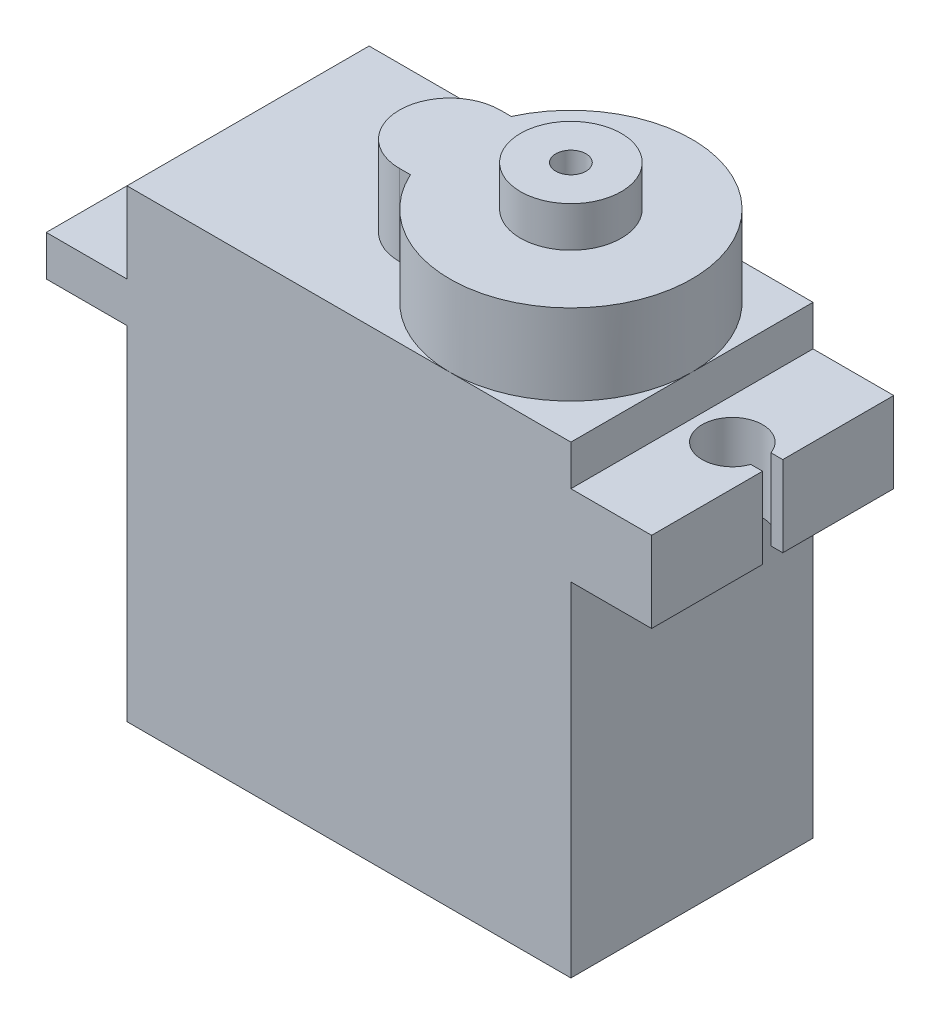
from build123d import *

# Parameters (mm, degrees)
CROQUIS1_W              = 22
CROQUIS1_H              = 23
SALIENTE_EXTRUIR1_DEPTH = 12
CROQUIS2_W              = 12
CROQUIS2_H              = 2
SALIENTE_EXTRUIR2_DEPTH = 5
CORTAR_EXTRUIR2_DEPTH   = 2
CROQUIS13_W             = 12
CROQUIS13_H             = 2
SALIENTE_EXTRUIR3_DEPTH = 4
CORTAR_EXTRUIR3_DEPTH   = 2
SALIENTE_EXTRUIR4_DEPTH = 4
CROQUIS16_R             = 2.5
SALIENTE_EXTRUIR5_DEPTH = 6
CROQUIS21_R             = 0.75
CORTAR_EXTRUIR6_DEPTH   = 2


with BuildPart() as part:
    # Croquis1 → Saliente-Extruir1 (new body)
    with BuildSketch(Plane.XY):
        with Locations((-25.140327955, -0.424857882)):
            Rectangle(CROQUIS1_W, CROQUIS1_H)
    extrude(amount=SALIENTE_EXTRUIR1_DEPTH)

    # Croquis2 → Saliente-Extruir2 (add)
    with BuildSketch(Plane(origin=(-14.140327955, 0, 0), x_dir=(0, 0, -1), z_dir=(1, 0, 0))):
        with Locations((-6, 6.075142118)):
            Rectangle(CROQUIS2_W, CROQUIS2_H)
    saliente_extruir2 = extrude(amount=SALIENTE_EXTRUIR2_DEPTH)

    # Croquis3 → Cortar-Extruir2 (cut)
    with BuildSketch(Plane(origin=(0, 7.075142118, 0), x_dir=(1, 0, 0), z_dir=(0, 1, 0))):
        with BuildLine():
            Line((-10.140327955, -5.5), (-10.726114393, -5.5))
            ThreePointArc((-10.726114393, -5.5), (-13.640327955, -6), (-10.726114393, -6.5))
            Line((-10.726114393, -6.5), (-10.140327955, -6.5))
            Line((-10.140327955, -6.5), (-10.140327955, -12))
            Line((-10.140327955, -12), (-9.140327955, -12))
            Line((-9.140327955, -12), (-9.140327955, 0))
            Line((-9.140327955, 0), (-10.140327955, 0))
            Line((-10.140327955, 0), (-10.140327955, -5.5))
        make_face()
    cortar_extruir2 = extrude(amount=-CORTAR_EXTRUIR2_DEPTH, mode=Mode.SUBTRACT)

    # Simetría1: Saliente-Extruir2, Cortar-Extruir2 across plane
    add(saliente_extruir2.mirror(Plane(origin=(-9.140327955, 7.075142118, 12), x_dir=(0, 0, 1), z_dir=(0, -1, 0))))
    add(cortar_extruir2.mirror(Plane(origin=(-9.140327955, 7.075142118, 12), x_dir=(0, 0, 1), z_dir=(0, -1, 0))), mode=Mode.SUBTRACT)

    # Croquis13 → Saliente-Extruir3 (add)
    with BuildSketch(Plane.ZY.offset(36.140327955)):
        with Locations((6, 6.075142118)):
            Rectangle(CROQUIS13_W, CROQUIS13_H)
    extrude(amount=SALIENTE_EXTRUIR3_DEPTH)

    # Croquis14 → Cortar-Extruir3 (cut)
    with BuildSketch(Plane(origin=(0, 7.075142118, 0), x_dir=(1, 0, 0), z_dir=(0, 1, 0))):
        with BuildLine():
            Line((-40.140327955, -6.5), (-40.140327955, -5.5))
            Line((-40.140327955, -5.5), (-39.554541518, -5.5))
            ThreePointArc((-39.554541518, -5.5), (-36.640327955, -6), (-39.554541518, -6.5))
            Line((-39.554541518, -6.5), (-40.140327955, -6.5))
        make_face()
    extrude(amount=-CORTAR_EXTRUIR3_DEPTH, mode=Mode.SUBTRACT)

    # Croquis15 → Saliente-Extruir4 (add)
    with BuildSketch(Plane(origin=(0, 11.075142118, 0), x_dir=(1, 0, 0), z_dir=(0, 1, 0))):
        with BuildLine():
            ThreePointArc((-26.140327955, -3.5), (-28.640327955, -6), (-26.140327955, -8.5))
            Line((-26.140327955, -8.5), (-25.594684013, -8.5))
            ThreePointArc((-25.594684013, -8.5), (-14.140327955, -6), (-25.594684013, -3.5))
            Line((-25.594684013, -3.5), (-26.140327955, -3.5))
        make_face()
    extrude(amount=SALIENTE_EXTRUIR4_DEPTH)

    # Croquis16 → Saliente-Extruir5 (add)
    with BuildSketch(Plane(origin=(0, 11.075142118, 0), x_dir=(1, 0, 0), z_dir=(0, 1, 0))):
        with Locations((-20.140327955, -6)):
            Circle(CROQUIS16_R)
    extrude(amount=SALIENTE_EXTRUIR5_DEPTH)

    # Croquis21 → Cortar-Extruir6 (cut)
    with BuildSketch(Plane(origin=(0, 17.075142118, 0), x_dir=(1, 0, 0), z_dir=(0, 1, 0))):
        with Locations((-20.140327955, -6)):
            Circle(CROQUIS21_R)
    extrude(amount=-CORTAR_EXTRUIR6_DEPTH, mode=Mode.SUBTRACT)


solid = part.part
